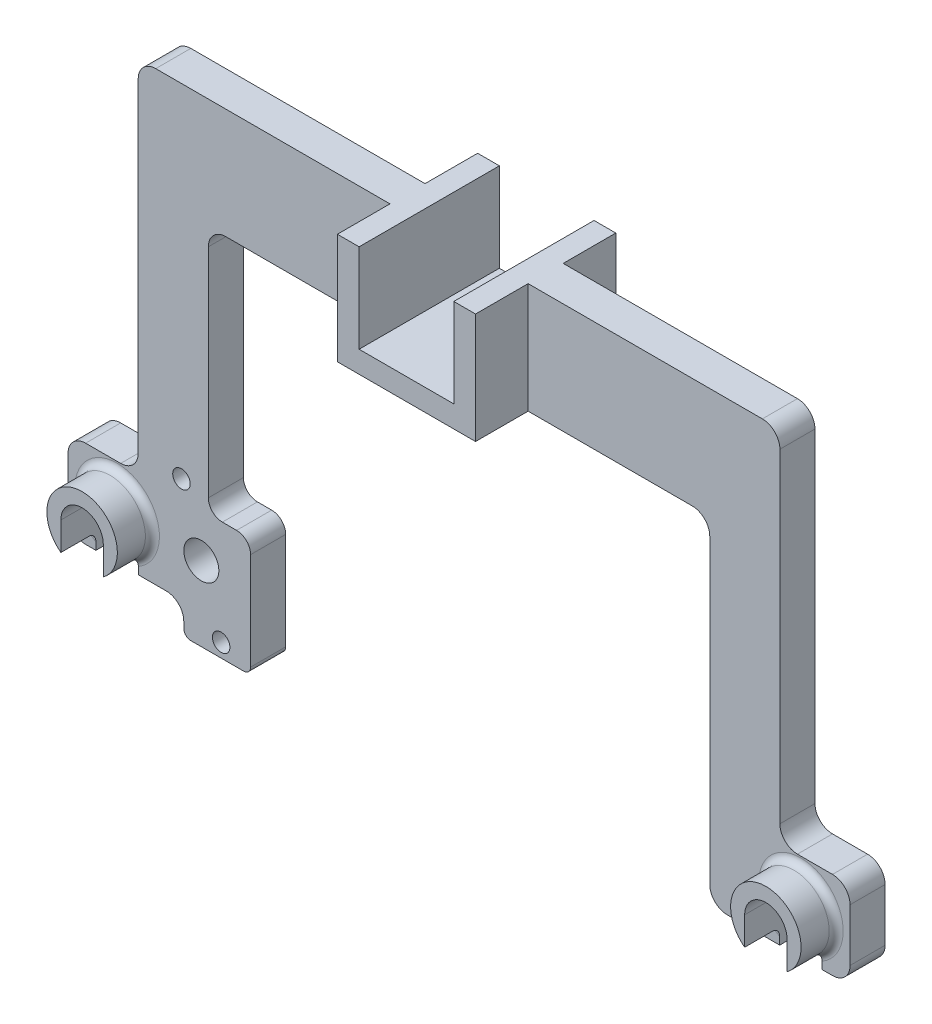
from build123d import *

# Parameters (mm, degrees)
SKETCH1_R                = 6.05
SKETCH1_R_2              = 5
SKETCH1_R_3              = 2.5
BOSS_EXTRUDE1_DEPTH      = 10
FILLET1_R                = 5
SKETCH2_R                = 10.05
SKETCH2_R_2              = 6.05
BOSS_EXTRUDE2_DEPTH      = 10
FILLET2_R                = 2
FILLET1_OF_MIRROR2_R     = 5
FILLET2_OF_MIRROR2_R     = 2
SKETCH13_W               = 27
SKETCH13_H               = 25.3
CUT_EXTRUDE9_DEPTH       = 20
BOSS_EXTRUDE5_DEPTH      = 15
BOSS_EXTRUDE5_DEPTH_BACK = 25
SKETCH15_R               = 4
CUT_EXTRUDE10_DEPTH      = 15
CUT_EXTRUDE11_DEPTH      = 15
CUT_EXTRUDE11_DEPTH_BACK = 15
SKETCH16_W               = 12.1
SKETCH16_H               = 14.444803796
BOSS_EXTRUDE6_START      = -10
SKETCH17_R               = 5
SKETCH17_R_2             = 2.5
BOSS_EXTRUDE6_DEPTH      = 10
SKETCH18_R               = 2.5
CUT_EXTRUDE12_DEPTH      = 36
FILLET4_R                = 5


with BuildPart() as part:
    # Sketch1 → Boss-Extrude1 (new body)
    with BuildSketch(Plane.XY):
        with BuildLine():
            Line((-98.7, -12.5), (-65.704175883, -12.5))
            Line((-65.704175883, -12.5), (-65.704175883, -21.268406651))
            Line((-65.704175883, -21.268406651), (-46.640834573, -21.268406651))
            Line((-46.640834573, -21.268406651), (-46.640834573, 8.5))
            ThreePointArc((-46.640834573, 8.5), (-47.812407448, 11.328427125), (-50.640834573, 12.5))
            Line((-50.640834573, 12.5), (-54.7, 12.5))
            ThreePointArc((-54.7, 12.5), (-57.528427125, 13.671572875), (-58.7, 16.5))
            Line((-58.7, 16.5), (-58.7, 78.5))
            ThreePointArc((-58.7, 78.5), (-57.235533906, 82.035533906), (-53.7, 83.5))
            Line((-53.7, 83.5), (12.8, 83.5))
            Line((12.8, 83.5), (12.8, 115))
            Line((12.8, 115), (-73.7, 115))
            ThreePointArc((-73.7, 115), (-77.235533906, 113.535533906), (-78.7, 110))
            Line((-78.7, 110), (-78.7, 12.5))
            Line((-78.7, 12.5), (-98.7, 12.5))
            Line((-98.7, 12.5), (-98.7, -12.5))
        make_face()
        with Locations((-84.7, 0)):
            Circle(SKETCH1_R, mode=Mode.SUBTRACT)
        with Locations((-60.7, 0)):
            Circle(SKETCH1_R_2, mode=Mode.SUBTRACT)
        with Locations((-55.039798532, -17.350061076)):
            Circle(SKETCH1_R_3, mode=Mode.SUBTRACT)
        with Locations((-66.360201468, 17.350061076)):
            Circle(SKETCH1_R_3, mode=Mode.SUBTRACT)
    boss_extrude1 = extrude(amount=BOSS_EXTRUDE1_DEPTH)

    # Fillet1
    fillet1_edges = [part.edges().sort_by_distance(p)[0] for p in [
        (-65.704175883, -12.5, 5),
        (-98.7, 12.5, 5),
        (-98.7, -12.5, 5),
        (-78.7, 12.5, 5),
    ]]
    fillet(fillet1_edges, radius=FILLET1_R)

    # Sketch2 → Boss-Extrude2 (add)
    with BuildSketch(Plane.XY.offset(10)):
        with Locations((-84.7, 0)):
            Circle(SKETCH2_R)
        with Locations((-84.7, 0)):
            Circle(SKETCH2_R_2, mode=Mode.SUBTRACT)
    boss_extrude2 = extrude(amount=BOSS_EXTRUDE2_DEPTH)

    # Fillet2
    fillet2_edges = [part.edges().sort_by_distance(p)[0] for p in [
        (-94.75, 0, 10),
        (-46.640834573, -21.268406651, 5),
        (-65.704175883, -21.268406651, 5),
    ]]
    fillet(fillet2_edges, radius=FILLET2_R)

    # Mirror2: Boss-Extrude1, Boss-Extrude2 across plane
    add(boss_extrude1.mirror(Plane(origin=(12.8, 115, 10), x_dir=(0, 0, 1), z_dir=(-1, 0, 0))))
    add(boss_extrude2.mirror(Plane(origin=(12.8, 115, 10), x_dir=(0, 0, 1), z_dir=(-1, 0, 0))))

    # Fillet1 of Mirror2
    fillet1_of_mirror2_edges = [part.edges().sort_by_distance(p)[0] for p in [
        (91.304175883, -12.5, 5),
        (124.3, 12.5, 5),
        (124.3, -12.5, 5),
        (104.3, 12.5, 5),
    ]]
    fillet(fillet1_of_mirror2_edges, radius=FILLET1_OF_MIRROR2_R)

    # Fillet2 of Mirror2
    fillet2_of_mirror2_edges = [part.edges().sort_by_distance(p)[0] for p in [
        (120.35, 0, 10),
        (72.240834573, -21.268406651, 5),
        (91.304175883, -21.268406651, 5),
    ]]
    fillet(fillet2_of_mirror2_edges, radius=FILLET2_OF_MIRROR2_R)

    # Sketch13 → Cut-Extrude9 (cut)
    with BuildSketch(Plane.XY.offset(10)):
        with Locations((12.8, 102.35)):
            Rectangle(SKETCH13_W, SKETCH13_H)
    extrude(amount=-CUT_EXTRUDE9_DEPTH, mode=Mode.SUBTRACT)

    # Sketch14 → Boss-Extrude5 (add, two sides: drawn at the far end of the back side and taken through both)
    with BuildSketch(Plane.XY.offset(10).offset(-BOSS_EXTRUDE5_DEPTH_BACK)):
        Polygon((-6.9, 115), (-6.9, 83.5), (32.5, 83.5), (32.5, 115), (26.3, 115), (26.3, 89.7), (-0.7, 89.7), (-0.7, 115), align=None)
    extrude(amount=BOSS_EXTRUDE5_DEPTH + BOSS_EXTRUDE5_DEPTH_BACK)

    # Sketch15 → Cut-Extrude10 (cut)
    with BuildSketch(Plane.XZ.offset(-83.5)):
        with Locations((12.8, 5)):
            Circle(SKETCH15_R)
    extrude(amount=-CUT_EXTRUDE10_DEPTH, mode=Mode.SUBTRACT)

    # Sketch16 → Cut-Extrude11 (cut, two sides: drawn at the far end of the back side and taken through both)
    with BuildSketch(Plane.XY.offset(10).offset(-CUT_EXTRUDE11_DEPTH_BACK)):
        with Locations((-84.7, -7.222401898)):
            Rectangle(SKETCH16_W, SKETCH16_H)
        with Locations((110.3, -7.222401898)):
            Rectangle(SKETCH16_W, SKETCH16_H)
    extrude(amount=CUT_EXTRUDE11_DEPTH + CUT_EXTRUDE11_DEPTH_BACK, mode=Mode.SUBTRACT)

    # Sketch17 → Boss-Extrude6 (add)
    with BuildSketch(Plane.XY.offset(10).offset(BOSS_EXTRUDE6_START)):
        with Locations((86.3, 0)):
            Circle(SKETCH17_R)
        with Locations((91.960201468, 17.350061076)):
            Circle(SKETCH17_R_2)
    extrude(amount=BOSS_EXTRUDE6_DEPTH)

    # Sketch18 → Cut-Extrude12 (cut)
    with BuildSketch(Plane.XY.offset(10)):
        with BuildLine():
            Line((84.3, -12.5), (84.3, 16.5))
            ThreePointArc((84.3, 16.5), (83.128427125, 13.671572875), (80.3, 12.5))
            Line((80.3, 12.5), (76.240834573, 12.5))
            ThreePointArc((76.240834573, 12.5), (73.412407448, 11.328427125), (72.240834573, 8.5))
            Line((72.240834573, 8.5), (72.240834573, -19.268406651))
            ThreePointArc((72.240834573, -19.268406651), (72.826621011, -20.682620214), (74.240834573, -21.268406651))
            Line((74.240834573, -21.268406651), (89.304175883, -21.268406651))
            ThreePointArc((89.304175883, -21.268406651), (90.718389445, -20.682620214), (91.304175883, -19.268406651))
            Line((91.304175883, -19.268406651), (91.304175883, -17.5))
            ThreePointArc((91.304175883, -17.5), (92.768641977, -13.964466094), (96.304175883, -12.5))
            Line((96.304175883, -12.5), (84.3, -12.5))
        make_face()
        with Locations((80.639798532, -17.350061076)):
            Circle(SKETCH18_R, mode=Mode.SUBTRACT)
    extrude(amount=-CUT_EXTRUDE12_DEPTH, mode=Mode.SUBTRACT)

    # Fillet4
    fillet4_edges = [part.edges().sort_by_distance(p)[0] for p in [
        (84.3, -12.5, 5),
    ]]
    fillet(fillet4_edges, radius=FILLET4_R)


solid = part.part
